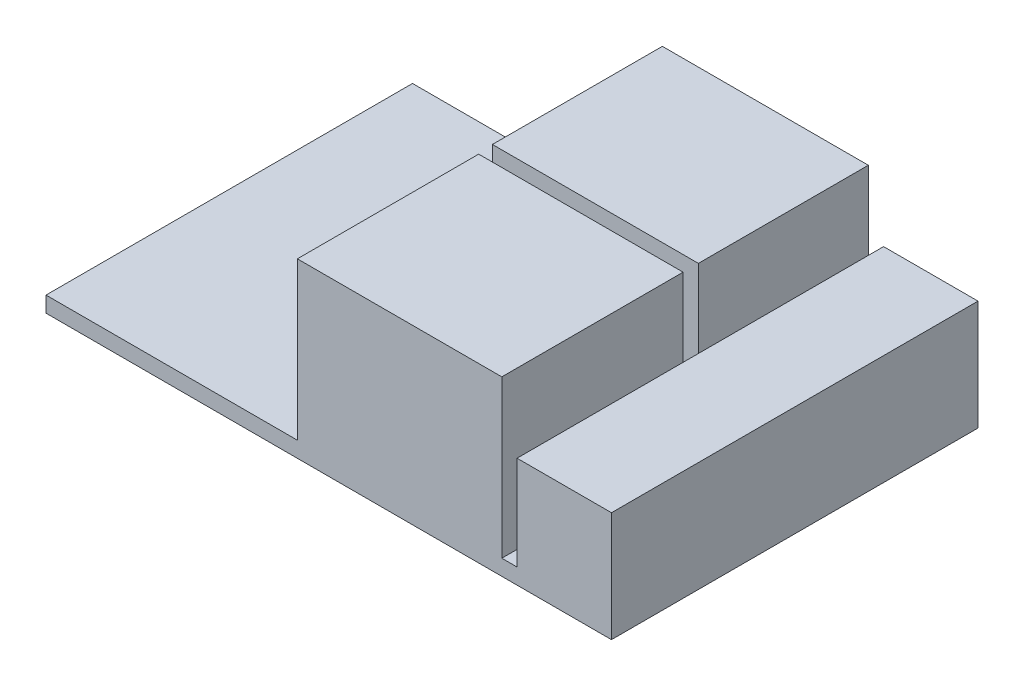
from build123d import *

# Parameters (mm, degrees)
EXTRUDE_1_DEPTH = 1.5
SKETCH_2_W      = 9.016092248
SKETCH_2_H      = 35
SKETCH_2_W_2    = 19.66831863
SKETCH_2_H_2    = 16.230096049
SKETCH_2_W_3    = 19.52262738
SKETCH_2_H_3    = 17.31299146
EXTRUDE_2_DEPTH = 9
SKETCH_3_W      = 19.66831863
SKETCH_3_H      = 16.230096049
SKETCH_3_W_2    = 19.52262738
SKETCH_3_H_2    = 17.31299146
EXTRUDE_3_DEPTH = 6


with BuildPart() as part:
    # 草图1 → 凸台-拉伸1 (new body)
    with BuildSketch(Plane(origin=(0, 0, 0), x_dir=(1, 0, 0), z_dir=(0, 1, 0))):
        Polygon((23.801977214, 137.107926306), (0, 137.107926306), (0, 102.107926306), (23.801977214, 102.107926306), (45.259202963, 102.107926306), (47.278706563, 102.107926306), (54, 102.107926306), (54, 137.107926306), (47.278706563, 137.107926306), (45.259202963, 137.107926306), align=None)
    extrude(amount=EXTRUDE_1_DEPTH)

    # 草图2 → 凸台-拉伸2 (add)
    with BuildSketch(Plane(origin=(0, 1.5, 0), x_dir=(1, 0, 0), z_dir=(0, 1, 0))):
        with Locations((49.491953876, 119.607926306)):
            Rectangle(SKETCH_2_W, SKETCH_2_H)
        with Locations((33.692835946, 128.992878281)):
            Rectangle(SKETCH_2_W_2, SKETCH_2_H_2)
        with Locations((33.765681571, 110.764422036)):
            Rectangle(SKETCH_2_W_3, SKETCH_2_H_3)
    extrude(amount=EXTRUDE_2_DEPTH)

    # 草图3 → 凸台-拉伸3 (add)
    with BuildSketch(Plane(origin=(0, 10.5, 0), x_dir=(1, 0, 0), z_dir=(0, 1, 0))):
        with Locations((33.692835946, 128.992878281)):
            Rectangle(SKETCH_3_W, SKETCH_3_H)
        with Locations((33.765681571, 110.764422036)):
            Rectangle(SKETCH_3_W_2, SKETCH_3_H_2)
    extrude(amount=EXTRUDE_3_DEPTH)


solid = part.part
